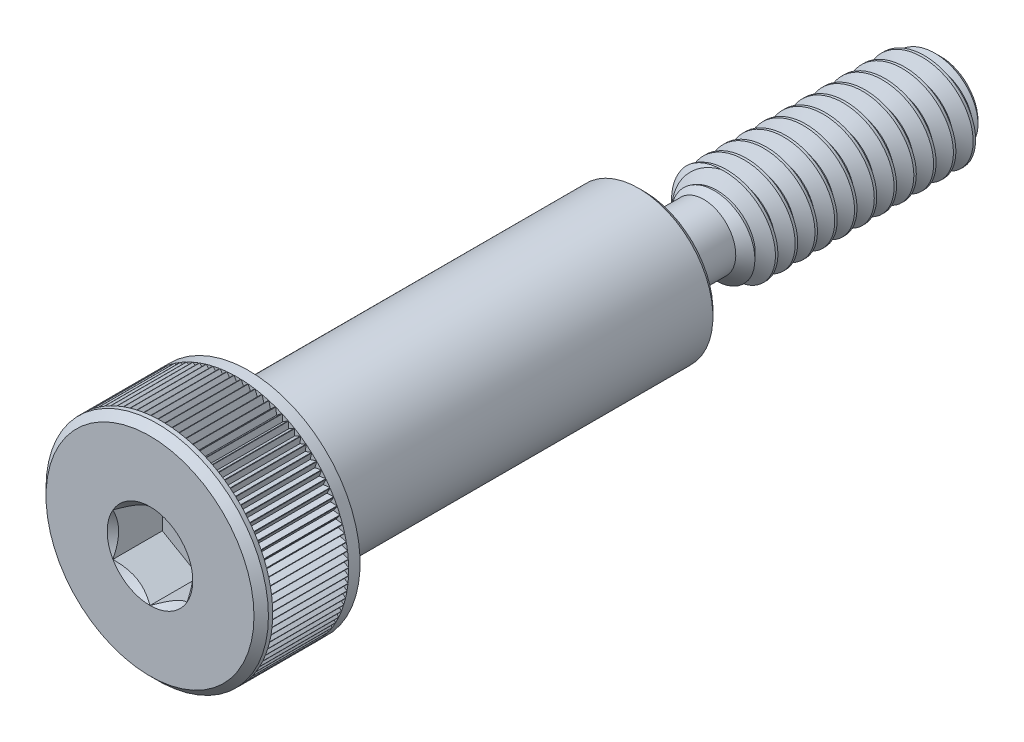
from build123d import *

# Parameters (mm, degrees)
SKETCH12_R          = 3.175
BOSS_EXTRUDE1_DEPTH = 19.05
CHAMFER1_SIZE       = 0.79375
CHAMFER2_SIZE       = 0.46434375
FILLET1_R           = 0.3175
CUT_EXTRUDE2_DEPTH  = 3.175
CUT_SWEEP1_PITCH    = 1.27
SKETCH14_R          = 1.5875
BOSS_EXTRUDE2_DEPTH = 17.145
CUT_EXTRUDE5_DEPTH  = 2.439590625
CIRPATTERN1_COUNT   = 99


with BuildPart() as part:
    # Sketch13 → Revolve1 (revolve)
    with BuildSketch(Plane(origin=(0, 0, 0), x_dir=(0, 0, -1), z_dir=(1, 0, 0)), mode=Mode.PRIVATE) as revolve1_sk:
        Polygon((0, 0), (0, 7.14375), (6.35, 7.14375), (6.35, 4.4053125), (7.62, 4.4053125), (7.9771875, 4.7625), (31.3928125, 4.7625), (31.75, 4.4053125), (31.75, 0), align=None)
    revolve(revolve1_sk.sketch.rotate(Axis((0, 0, -31.75), (0, 0, 1)), 90), axis=Axis((0, 0, -31.75), (0, 0, 1)))

    # Sketch12 → Boss-Extrude1 (add)
    with BuildSketch(Plane(origin=(0, 0, -31.75), x_dir=(-1, 0, 0), z_dir=(0, 0, -1))):
        Circle(SKETCH12_R)
    extrude(amount=BOSS_EXTRUDE1_DEPTH)

    # Sketch5 → Cut-Revolve1 (revolve, cut)
    with BuildSketch(Plane(origin=(0, 0, 0), x_dir=(0, 0, -1), z_dir=(1, 0, 0))):
        Polygon((31.75, 3.175), (36.67125, 3.175), (35.56, 2.06375), (31.75, 2.06375), align=None)
    revolve(axis=Axis((0, 0, -31.75), (0, 0, 1)), mode=Mode.SUBTRACT)

    # Chamfer1
    chamfer1_edges = [part.edges().sort_by_distance(p)[0] for p in [
        (3.175, 0, -50.8),
    ]]
    chamfer(chamfer1_edges, length=CHAMFER1_SIZE)

    # Chamfer2
    chamfer2_edges = [part.edges().sort_by_distance(p)[0] for p in [
        (7.14375, 0, 0),
    ]]
    chamfer(chamfer2_edges, length=CHAMFER2_SIZE)

    # Fillet1
    fillet1_edges = [part.edges().sort_by_distance(p)[0] for p in [
        (0, -2.06375, -31.75),
    ]]
    fillet(fillet1_edges, radius=FILLET1_R)

    # Sketch8 → Cut-Extrude2 (cut)
    with BuildSketch(Plane.XY):
        Polygon((2.38125, 1.374815329), (0, 2.749630657), (-2.38125, 1.374815329), (-2.38125, -1.374815329), (0, -2.749630657), (2.38125, -1.374815329), align=None)
    extrude(amount=-CUT_EXTRUDE2_DEPTH, mode=Mode.SUBTRACT)

    # Cut-Extrude4 cone 1 section (through the dimple's axis) → Cut-Extrude4 (revolve, cut)
    with BuildSketch(Plane(origin=(0, 0, 0), x_dir=(0, -1, 0), z_dir=(1, 0, 0))):
        Polygon((0, 0), (2.749630657, 0), (0, 2.749630657), align=None)
    revolve(axis=Axis((0, 0, 0), (0, 0, -1)), mode=Mode.SUBTRACT)


with BuildPart() as body_2:
    # Split1: the piece on the far side of the plane
    add(part.part)
    split(bisect_by=Plane.XY.offset(-31.75), keep=Keep.BOTTOM)

    # Cut-Sweep1: the profile of Sketch4 screwed along a right-hand helix of 14 turns, 8 arcs to a turn; built about Z, then put on its axis
    cut_sweep1_z = Axis((0, 0, 0), (0, 0, 1))
    cut_sweep1_corners = [(2.350110803, 0, -0.47625), (2.350110803, 0, -0.635), (3.243740766, 0, -1.1509375), (3.243740766, 0, -0.555625), (3.243740766, 0, 0.0396875)]
    with BuildLine(mode=Mode.PRIVATE) as cut_sweep1_profile:
        Line(cut_sweep1_corners[0], cut_sweep1_corners[1])
        Line(cut_sweep1_corners[1], cut_sweep1_corners[2])
        Line(cut_sweep1_corners[2], cut_sweep1_corners[3])
        Line(cut_sweep1_corners[3], cut_sweep1_corners[4])
        Line(cut_sweep1_corners[4], cut_sweep1_corners[0])
    cut_sweep1_cap = Face(cut_sweep1_profile.wire())
    cut_sweep1_turn_angles = [0, 22.5, 45, 67.5, 90, 112.5, 135, 157.5, 180, 202.5, 225, 247.5, 270, 292.5, 315, 337.5, 360]
    cut_sweep1_turn_weights = [1, 0.9238795325112867, 1, 0.9238795325112867, 1, 0.9238795325112867, 1, 0.9238795325112867, 1, 0.9238795325112867, 1, 0.9238795325112867, 1, 0.9238795325112867, 1, 0.9238795325112867, 1]
    cut_sweep1_turn_rails = [Edge.make_bspline([Vector(p[0], p[1], 0).rotate(cut_sweep1_z, cut_sweep1_turn_angles[k]) / cut_sweep1_turn_weights[k] + Vector(0, 0, p[2] + CUT_SWEEP1_PITCH * cut_sweep1_turn_angles[k] / 360) for k in range(17)], [0, 0, 0, 1, 1, 2, 2, 3, 3, 4, 4, 5, 5, 6, 6, 7, 7, 8, 8, 8], 2, cut_sweep1_turn_weights) for p in cut_sweep1_corners]
    cut_sweep1_turn_sides = [Face.make_surface_from_curves(cut_sweep1_turn_rails[p[0]], cut_sweep1_turn_rails[p[1]]) for p in [(0, 1), (1, 2), (2, 3), (3, 4), (4, 0)]]
    cut_sweep1 = Plane(origin=(0, 0, -50.8), x_dir=(0, 1, 0), z_dir=(0, 0, 1)) * Solid(Shell([*[p.moved(Location((0, 0, CUT_SWEEP1_PITCH * i))) for i in range(14) for p in cut_sweep1_turn_sides], cut_sweep1_cap, cut_sweep1_cap.rotate(cut_sweep1_z, 5040).moved(Location((0, 0, CUT_SWEEP1_PITCH * 5040 / 360)))]))
    add(cut_sweep1, mode=Mode.SUBTRACT)


with BuildPart() as part_1:
    add(part.part)

    # Split1
    split(bisect_by=Plane.XY.offset(-31.75), keep=Keep.TOP)

    add(body_2.part)  # Boss-Extrude2 merges body 2
    # Sketch14 → Boss-Extrude2 (add)
    with BuildSketch(Plane(origin=(0, 0, -31.75), x_dir=(-1, 0, 0), z_dir=(0, 0, -1))):
        Circle(SKETCH14_R)
    extrude(amount=BOSS_EXTRUDE2_DEPTH)

    # Sketch11 → Cut-Extrude5 (cut, symmetric)
    with BuildSketch(Plane.XY.offset(-3.175)):
        Polygon((0, 6.772275), (0.214471191, 7.14375), (-0.214471191, 7.14375), align=None)
    cut_extrude5 = extrude(amount=CUT_EXTRUDE5_DEPTH, both=True, mode=Mode.SUBTRACT)

    # CirPattern1: Cut-Extrude5 ×99 about axis
    cirpattern1_axis = Axis((0, 0, 0), (0, 0, 1))
    for i in range(1, CIRPATTERN1_COUNT):
        add(cut_extrude5.rotate(cirpattern1_axis, i * 360 / CIRPATTERN1_COUNT), mode=Mode.SUBTRACT)


solid = part_1.part
